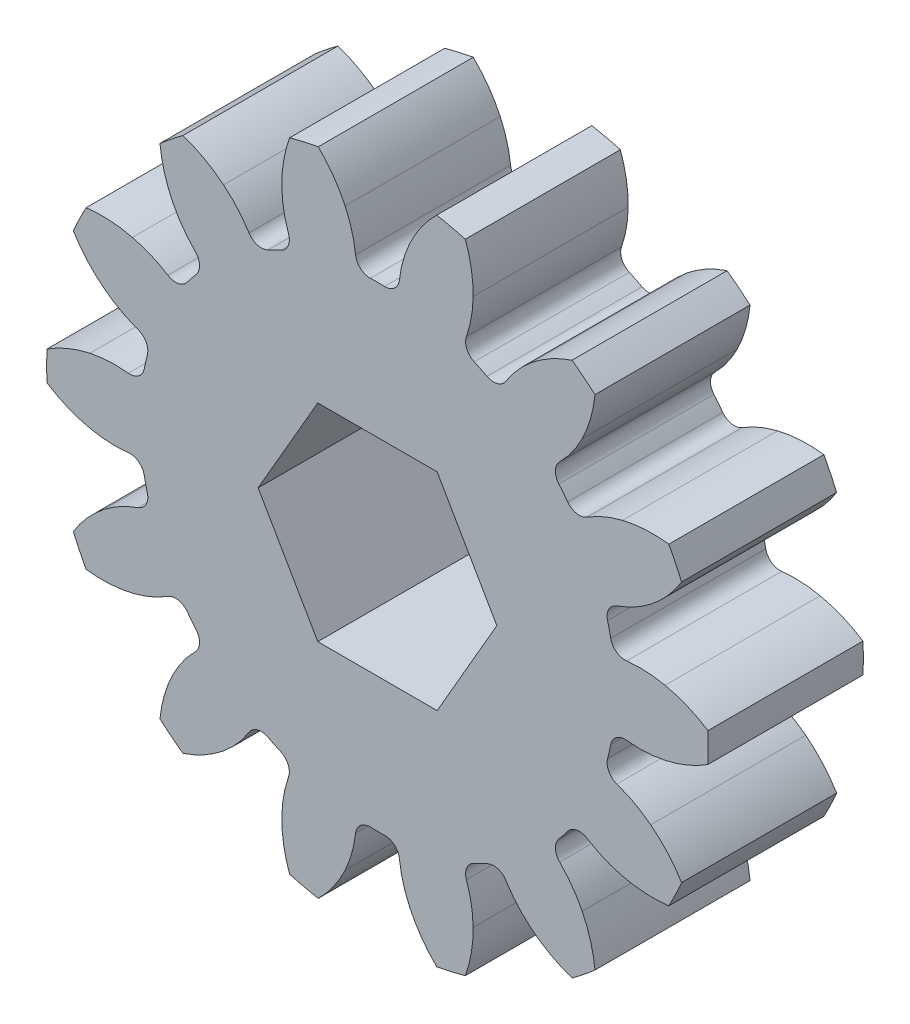
from build123d import *

# Parameters (mm, degrees)
SKETCH1_R            = 20.32
ROUND_STOCK_DEPTH    = 4.7625
SINGLE_TOOTH_DEPTH   = 31.2742535
TOOTH_PATTERN_COUNT  = 14
ROUNDBORE_DEPTH      = 29.900711397
ROUNDBORE_DEPTH_BACK = 29.900711397
SKETCH5_R            = 2.5781
CUT_EXTRUDE1_DEPTH   = 31.054872117


with BuildPart() as part:
    # Sketch1 → Round Stock (new, symmetric)
    with BuildSketch(Plane.XY):
        Circle(SKETCH1_R)
    extrude(amount=ROUND_STOCK_DEPTH, both=True)

    # Sketch2 → Single Tooth (cut, through all)
    with BuildSketch(Plane.XY.offset(4.7625)):
        with BuildLine():
            ThreePointArc((-18.680915437, -7.995361057), (-19.810535176, -4.521625378), (-20.299980384, -0.90177404))
            ThreePointArc((-20.299980384, -0.90177404), (-19.033050608, -1.566940336), (-17.667702077, -1.99517))
            ThreePointArc((-17.667702077, -1.99517), (-16.49068842, -2.15119119), (-15.304023152, -2.112084878))
            ThreePointArc((-15.304023152, -2.112084878), (-14.677649752, -2.277093918), (-14.329509817, -2.823326657))
            ThreePointArc((-14.329509817, -2.823326657), (-14.238822157, -3.24991824), (-14.135437764, -3.673611877))
            ThreePointArc((-14.135437764, -3.673611877), (-14.212099504, -4.316802827), (-14.704847698, -4.737244067))
            ThreePointArc((-14.704847698, -4.737244067), (-15.790963753, -5.216885261), (-16.783721358, -5.868142582))
            ThreePointArc((-16.783721358, -5.868142582), (-17.828055991, -6.846366704), (-18.680915437, -7.995361057))
        make_face()
    single_tooth = extrude(amount=-SINGLE_TOOTH_DEPTH, mode=Mode.SUBTRACT)

    # Tooth Pattern: Single Tooth ×14 about axis
    tooth_pattern_axis = Axis((0, 0, 50), (0, 0, -1))
    for i in range(1, TOOTH_PATTERN_COUNT):
        add(single_tooth.rotate(tooth_pattern_axis, i * 360 / TOOTH_PATTERN_COUNT), mode=Mode.SUBTRACT)

    # Sketch5 → RoundBore (cut, two sides: drawn at the far end of the back side and taken through both)
    with BuildSketch(Plane.XY.offset(-ROUNDBORE_DEPTH_BACK)):
        Circle(SKETCH5_R)
    extrude(amount=ROUNDBORE_DEPTH + ROUNDBORE_DEPTH_BACK, mode=Mode.SUBTRACT)

    # Sketch8 → Cut-Extrude1 (cut, through all)
    with BuildSketch(Plane(origin=(0, 0, -4.7625), x_dir=(-1, 0, 0), z_dir=(0, 0, -1))):
        Polygon((3.666174209, -6.35), (7.332348419, 0), (3.666174209, 6.35), (-3.666174209, 6.35), (-7.332348419, 0), (-3.666174209, -6.35), align=None)
    extrude(amount=-CUT_EXTRUDE1_DEPTH, mode=Mode.SUBTRACT)


solid = part.part
